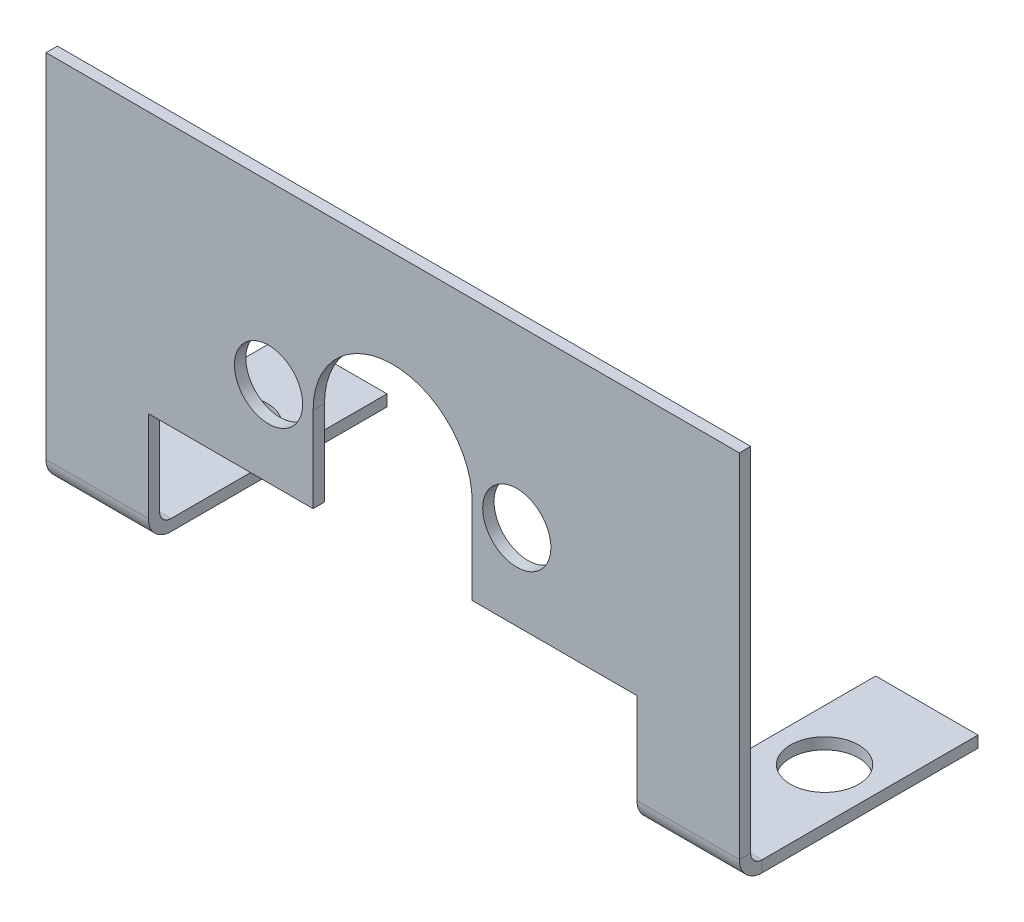
from build123d import *

# Parameters (mm, degrees)
BRIDA_BASE1_DEPTH     = 30.5
CROQUIS12_R           = 1.5
CORTAR_EXTRUIR1_DEPTH = 12
CROQUIS13_R           = 1.5
CORTAR_EXTRUIR2_DEPTH = 12


# Sheet-metal steps are written as plain solids
with BuildPart() as part:
    # Croquis1 → Brida base1 (new body)
    with BuildSketch(Plane(origin=(0, 0, 0), x_dir=(0, 0, -1), z_dir=(1, 0, 0))):
        with BuildLine():
            Line((-59.724940778, -1.485262267), (-59.724940778, -16.985262267))
            ThreePointArc((-59.724940778, -16.985262267), (-59.578494169, -17.338815658), (-59.224940778, -17.485262267))
            Line((-59.224940778, -17.485262267), (-49.724940778, -17.485262267))
            Line((-49.724940778, -17.485262267), (-49.724940778, -17.985262267))
            Line((-49.724940778, -17.985262267), (-59.224940778, -17.985262267))
            ThreePointArc((-59.224940778, -17.985262267), (-59.93204756, -17.692369049), (-60.224940778, -16.985262267))
            Line((-60.224940778, -16.985262267), (-60.224940778, -1.485262267))
            Line((-60.224940778, -1.485262267), (-59.724940778, -1.485262267))
        make_face()
    extrude(amount=BRIDA_BASE1_DEPTH)

    # Croquis12 → Cortar-Extruir1 (cut)
    with BuildSketch(Plane.XY.offset(60.224940778)):
        with Locations((9.79, -9.235262267)):
            Circle(CROQUIS12_R)
        with Locations(Location((20.71, -9.235262267, 0), (0, 0, 90))):
            Circle(CROQUIS12_R)
        with BuildLine():
            Line((11.75, -9.235262267), (11.75, -12.985262267))
            Line((11.75, -12.985262267), (4.5, -12.985262267))
            Line((4.5, -12.985262267), (4.5, -17.985262267))
            Line((4.5, -17.985262267), (11.75, -17.985262267))
            Line((11.75, -17.985262267), (18.75, -17.985262267))
            Line((18.75, -17.985262267), (26, -17.985262267))
            Line((26, -17.985262267), (26, -12.985262267))
            Line((26, -12.985262267), (18.75, -12.985262267))
            Line((18.75, -12.985262267), (18.75, -9.235262267))
            ThreePointArc((18.75, -9.235262267), (15.25, -5.735262267), (11.75, -9.235262267))
        make_face()
    extrude(amount=-CORTAR_EXTRUIR1_DEPTH, mode=Mode.SUBTRACT)

    # Croquis13 → Cortar-Extruir2 (cut)
    with BuildSketch(Plane(origin=(0, -17.485262267, 0), x_dir=(-1, 0, 0), z_dir=(0, 1, 0))):
        with Locations(Location((-28.25, 54.224940778, 0), (0, 0, 90))):
            Circle(CROQUIS13_R)
        with Locations(Location((-2.25, 54.224940778, 0), (0, 0, 90))):
            Circle(CROQUIS13_R)
    extrude(amount=-CORTAR_EXTRUIR2_DEPTH, mode=Mode.SUBTRACT)


solid = part.part
